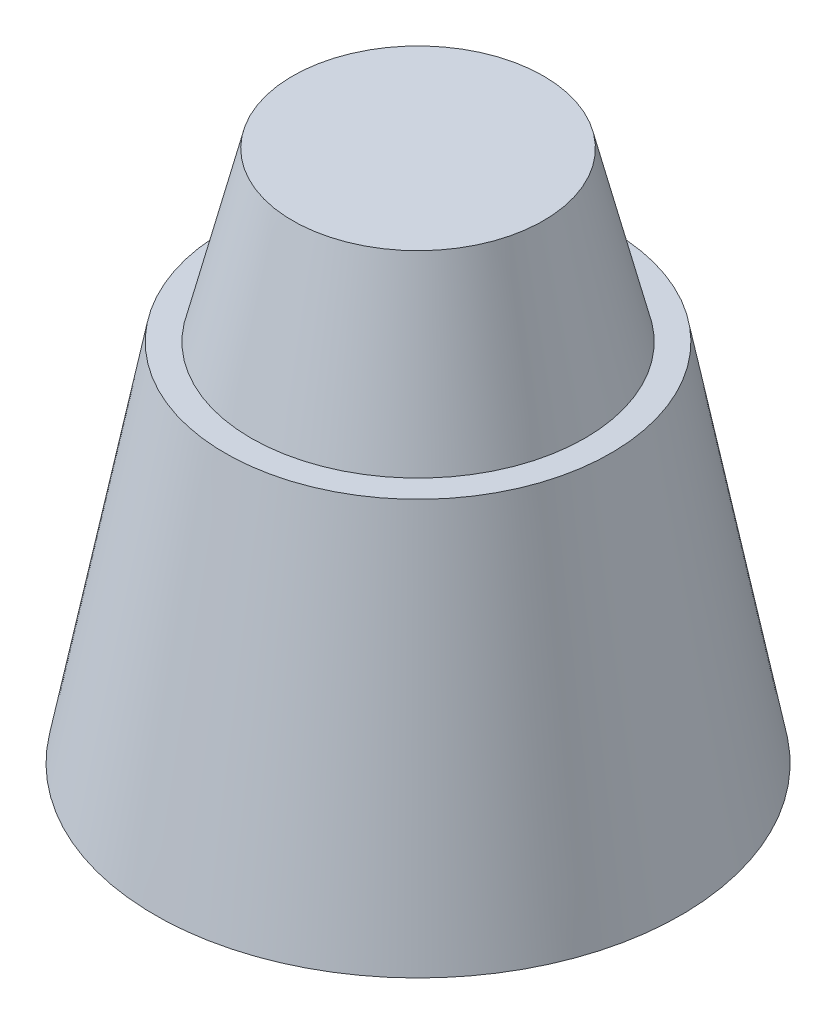
from build123d import *

# Parameters (mm, degrees)
SKETCH3_R          = 12.26998913
CUT_EXTRUDE1_DEPTH = 10
FILLET1_R          = 10
SKETCH4_R          = 2.26998913
CUT_EXTRUDE2_DEPTH = 10


with BuildPart() as part:
    # Sketch1 → Revolve1 (revolve)
    with BuildSketch(Plane.XY, mode=Mode.PRIVATE) as revolve1_sk:
        Polygon((558.630730273, 31.133640952), (561.480624089, 42.622275397), (570.080624089, 42.622275397), (570.080624089, 6.108010882), (552.040350824, 6.108010882), (556.849546639, 31.133640952), align=None)
    revolve(revolve1_sk.sketch.rotate(Axis((570.080624089, 6.108010882, 0), (0, 1, 0)), 270), axis=Axis((570.080624089, 6.108010882, 0), (0, 1, 0)))

    # Sketch3 → Cut-Extrude1 (cut)
    with BuildSketch(Plane(origin=(0, 6.108010882, 0), x_dir=(-1, 0, 0), z_dir=(0, -1, 0))):
        with Locations(Location((-570.080624089, 0, 0), (0, 0, 90))):
            Circle(SKETCH3_R)
    extrude(amount=-CUT_EXTRUDE1_DEPTH, mode=Mode.SUBTRACT)

    # Fillet1
    fillet1_edges = [part.edges().sort_by_distance(p)[0] for p in [
        (570.080624089, 16.108010882, 12.26998913),
    ]]
    fillet(fillet1_edges, radius=FILLET1_R - 0.0001)  # a hair under: the kernel refuses the full size

    # Sketch4 → Cut-Extrude2 (cut)
    with BuildSketch(Plane(origin=(0, 16.108010882, 0), x_dir=(-1, 0, 0), z_dir=(0, -1, 0))):
        with Locations(Location((-570.080624089, 0, 0), (0, 0, 90))):
            Circle(SKETCH4_R)
    extrude(amount=-CUT_EXTRUDE2_DEPTH, mode=Mode.SUBTRACT)


solid = part.part
